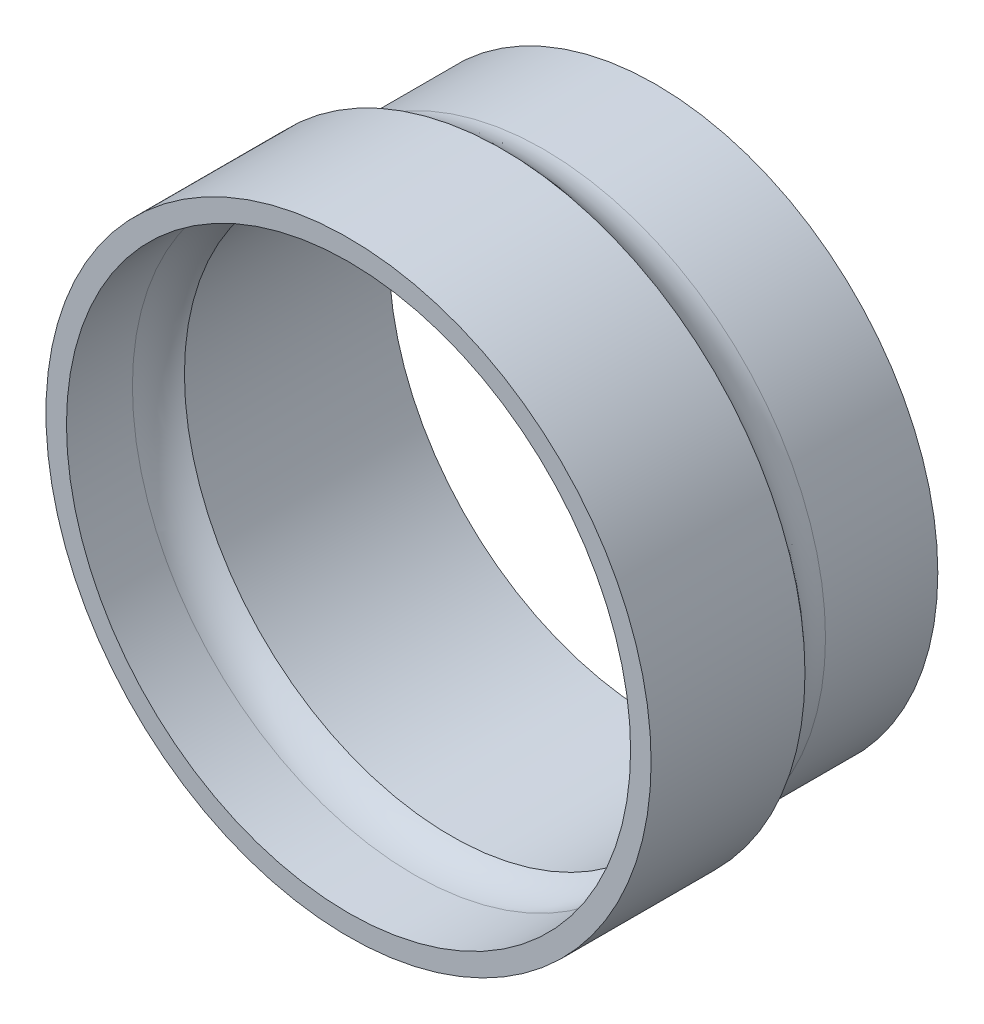
from build123d import *

# Parameters (mm, degrees)
SKETCH1_R              = 55
SKETCH1_R_2            = 3
BOSS_EXTRUDE1_DEPTH    = 39.9
SKETCH2_R              = 52
CUT_EXTRUDE1_DEPTH     = 60
CUT_EXTRUDE2_START     = -39.9
CUT_EXTRUDE2_OUTLINE_R = 3
CUT_EXTRUDE2_DEPTH     = 39.9
EXTRUDE_THIN1_START    = -10
SKETCH4_R              = 59
SKETCH4_R_2            = 55
EXTRUDE_THIN1_DEPTH    = 30
FILLET1_R              = 10
FILLET2_R              = 10


# Read off the part's stored shape, not the designer's step: Cut-Extrude2
with BuildPart() as part:
    # Sketch1 → Boss-Extrude1 (new body)
    with BuildSketch(Plane.XY):
        Circle(SKETCH1_R)
        Circle(SKETCH1_R_2, mode=Mode.SUBTRACT)
    extrude(amount=BOSS_EXTRUDE1_DEPTH)

    # Sketch2 → Cut-Extrude1 (cut)
    with BuildSketch(Plane.XY.offset(39.9)):
        Circle(SKETCH2_R)
        with BuildLine():
            Line((-41.361950208, 16.620711788), (-41.361950208, -16.620711788))
            ThreePointArc((-41.361950208, -16.620711788), (0, -44.576439802), (41.361950208, -16.620711788))
            Line((41.361950208, -16.620711788), (41.361950208, 16.620711788))
            ThreePointArc((41.361950208, 16.620711788), (0, 44.576439802), (-41.361950208, 16.620711788))
        make_face(mode=Mode.SUBTRACT)
    extrude(amount=-CUT_EXTRUDE1_DEPTH, mode=Mode.SUBTRACT)


with BuildPart() as cut_extrude1_piece_1:
    # of the separate pieces the step leaves, piece 1, a body of its own (cut_extrude1_pieces)
    add(part.part.solids().sort_by_distance((41.361950208, -16.620711788, 0))[0])

    # Cut-Extrude2 outline → Cut-Extrude2 (cut)
    with BuildSketch(Plane.XY.offset(39.9).offset(CUT_EXTRUDE2_START)):
        with BuildLine():
            Line((41.361950208, -16.620711788), (41.361950208, 16.620711788))
            ThreePointArc((41.361950208, 16.620711788), (0, 44.576439802), (-41.361950208, 16.620711788))
            Line((-41.361950208, 16.620711788), (-41.361950208, -16.620711788))
            ThreePointArc((-41.361950208, -16.620711788), (0, -44.576439802), (41.361950208, -16.620711788))
        make_face()
        Circle(CUT_EXTRUDE2_OUTLINE_R, mode=Mode.SUBTRACT)
    extrude(amount=CUT_EXTRUDE2_DEPTH, mode=Mode.SUBTRACT)


with BuildPart() as cut_extrude1_piece_2:
    # of the separate pieces the step leaves, piece 2, a body of its own (cut_extrude1_pieces)
    add(part.part.solids().sort_by_distance((55, 0, 0))[0])

    # Sketch4 → Extrude-Thin1 (add)
    with BuildSketch(Plane.XY.offset(39.9).offset(EXTRUDE_THIN1_START)):
        Circle(SKETCH4_R)
        Circle(SKETCH4_R_2, mode=Mode.SUBTRACT)
    extrude(amount=EXTRUDE_THIN1_DEPTH)

    # Fillet1
    # the kernel refuses this fillet: 10 mm, written as the material it adds along each edge
    with BuildSketch(Plane(origin=(0, 0, 29.9), x_dir=(1, 0, 0), z_dir=(0, -1, 0))) as fillet1_piece_1:
        with BuildLine():
            CenterArc((65, -8), FILLET1_R, 126.869897646, 53.130102354)
            Line((59, 0), (58.88, 0.16))
            ThreePointArc((58.88, 0.16), (57, 0.2), (55, 0.2))
            Line((55, 0.2), (54.8, 0))
            Line((54.8, 0), (54.8, -8))
            Line((54.8, -8), (55, -8))
        make_face()
    revolve(axis=Axis((0, 0, 29.9), (0, 0, 1)))

    # Fillet2
    # the kernel refuses this fillet: 10 mm, written as the material it adds along each edge
    with BuildSketch(Plane(origin=(0, 0, 39.9), x_dir=(1, 0, 0), z_dir=(0, -1, 0))) as fillet2_piece_1:
        with BuildLine():
            CenterArc((45, 7.141428429), FILLET2_R, 314.427004001, 45.572995999)
            Line((52, 0), (52.14, -0.142828569))
            ThreePointArc((52.14, -0.142828569), (53.5, -0.2), (55, -0.2))
            Line((55, -0.2), (55.2, 0))
            Line((55.2, 0), (55.2, 7.141428429))
            Line((55.2, 7.141428429), (55, 7.141428429))
        make_face()
    revolve(axis=Axis((0, 0, 39.9), (0, 0, 1)))


solid = cut_extrude1_piece_2.part
